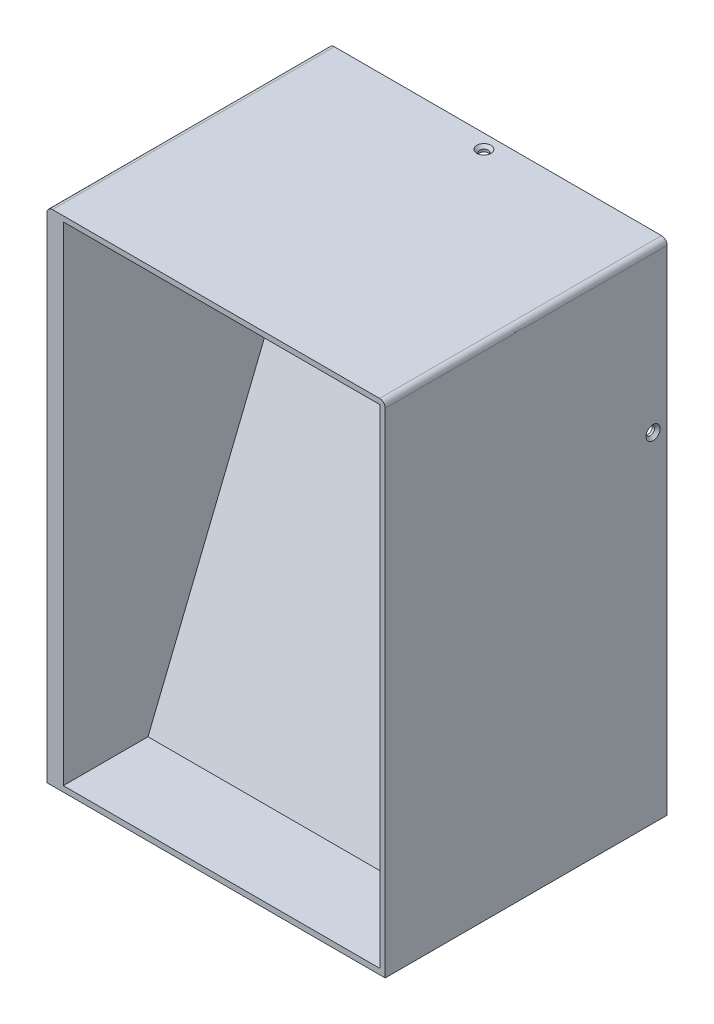
from build123d import *
from build123d.topology import SkipClean

# Parameters (mm, degrees)
SALIENTE_EXTRUIR1_DEPTH                              = 100
SALIENTE_EXTRUIR3_DEPTH                              = 60
CROQUIS8_R                                           = 7
CORTAR_EXTRUIR2_DEPTH                                = 7.5
CORTAR_EXTRUIR3_DEPTH                                = 25
SALIENTE_EXTRUIR5_REACH                              = 169.332
CROQUIS12_W                                          = 116.3
CROQUIS12_H                                          = 2
AVELLANADO_PARA_TORNILLO_CON_CABEZA_2_D              = 3
AVELLANADO_PARA_TORNILLO_CON_CABEZA_2_DEPTH          = 10
AVELLANADO_PARA_TORNILLO_CON_CABEZA_2_CSINK_D        = 5
AVELLANADO_PARA_TORNILLO_CON_CABEZA_2_CSINK_ANGLE    = 90
AVELLANADO_PARA_TORNILLO_CON_CABEZA_2_TIP            = 0.901290929
AVELLANADO_PARA_TORNILLO_CON_CABEZA_2_ON_D           = 3
AVELLANADO_PARA_TORNILLO_CON_CABEZA_2_ON_DEPTH       = 10
AVELLANADO_PARA_TORNILLO_CON_CABEZA_2_ON_CSINK_D     = 5
AVELLANADO_PARA_TORNILLO_CON_CABEZA_2_ON_CSINK_ANGLE = 90
AVELLANADO_PARA_TORNILLO_CON_CABEZA_2_ON_TIP         = 0.901290929
CROQUIS18_R                                          = 10
CROQUIS18_R_2                                        = 3.723403092
CORTAR_EXTRUIR6_DEPTH                                = 10
CROQUIS21_W                                          = 4
CROQUIS21_H                                          = 173.15
SALIENTE_EXTRUIR6_DEPTH                              = 90
CROQUIS22_W                                          = 86
CROQUIS22_H                                          = 172
CORTAR_EXTRUIR7_DEPTH                                = 3
CROQUIS23_W                                          = 3
CROQUIS23_H                                          = 172
CORTAR_EXTRUIR8_DEPTH                                = 2
CORTAR_EXTRUIR9_REACH                                = 195.972
CROQUIS24_W                                          = 3
CROQUIS24_H                                          = 10.09778391
CROQUIS25_W                                          = 116.3
CROQUIS25_H                                          = 2
CORTAR_EXTRUIR10_DEPTH                               = 10


# Read off the part's stored shape, not the designer's step: Recubrir-Lámina1
with BuildPart() as part:
    # Croquis1 → Saliente-Extruir1 (new body)
    with BuildSketch(Plane.XY):
        with BuildLine():
            Line((60, -120), (60, 55))
            ThreePointArc((60, 55), (59.414213562, 56.414213562), (58, 57))
            Line((58, 57), (-58, 57))
            ThreePointArc((-58, 57), (-59.414213562, 56.414213562), (-60, 55))
            Line((-60, 55), (-60, -120))
            Line((-60, -120), (60, -120))
        make_face()
        with BuildLine():
            Line((-57.95, -118), (57.95, -118))
            ThreePointArc((57.95, -118), (58.091421356, -117.941421356), (58.15, -117.8))
            Line((58.15, -117.8), (58.15, 54.95))
            ThreePointArc((58.15, 54.95), (58.091421356, 55.091421356), (57.95, 55.15))
            Line((57.95, 55.15), (-57.95, 55.15))
            ThreePointArc((-57.95, 55.15), (-58.091421356, 55.091421356), (-58.15, 54.95))
            Line((-58.15, 54.95), (-58.15, -117.8))
            ThreePointArc((-58.15, -117.8), (-58.091421356, -117.941421356), (-57.95, -118))
        make_face(mode=Mode.SUBTRACT)
    extrude(amount=SALIENTE_EXTRUIR1_DEPTH)

    # Croquis2 → Saliente-Extruir3 (add, symmetric)
    with BuildSketch(Plane(origin=(0, 0, 0), x_dir=(0, 0, -1), z_dir=(1, 0, 0))):
        Polygon((-51.903464864, 55.258422081), (-20, 0), (-67.842054117, -118.071815959), (-70, -118.071815959), (-22.220404934, -0.154145841), (-54.21286594, 55.258422081), align=None)
    extrude(amount=SALIENTE_EXTRUIR3_DEPTH, both=True)

    # Croquis6 → Revolución1 (revolve)
    with BuildSketch(Plane(origin=(0, 0, 0), x_dir=(0, 0, -1), z_dir=(1, 0, 0)), mode=Mode.PRIVATE) as revoluci_n1_sk:
        Polygon((-24.041451884, 7), (-25.773502692, 10), (-18.294962095, 10), (-18.294962095, 8), (-8.294962095, 8), (-8.294962095, 5), (-23.294962095, 5), (-23.294962095, 7), align=None)
    revolve(revoluci_n1_sk.sketch.rotate(Axis((0, 0, -70), (0, 0, 1)), 90), axis=Axis((0, 0, -70), (0, 0, 1)))

    # Croquis8 → Cortar-Extruir2 (cut, symmetric)
    with SkipClean():  # the faces are left unmerged after this step: merging them gives an invalid solid
        with BuildSketch(Plane.XY.offset(23.294962095)):
            with Locations(Location((0, 0, 0), (0, 0, 154.623066475))):
                Circle(CROQUIS8_R)
        extrude(amount=CORTAR_EXTRUIR2_DEPTH, both=True, mode=Mode.SUBTRACT)

    # Croquis10 → Cortar-Extruir3 (cut, symmetric)
    with BuildSketch(Plane(origin=(0, 0, 0), x_dir=(0, 0, -1), z_dir=(1, 0, 0))):
        Polygon((-29.700523202, 12.801799046), (-22.675993136, 0.634956072), (-22.220404934, -0.154145841), (-27.761841087, -13.830135337), (-29.486165756, -12.415050666), align=None)
    extrude(amount=CORTAR_EXTRUIR3_DEPTH, both=True, mode=Mode.SUBTRACT)

    # Saliente-Extruir5: up to this plane
    saliente_extruir5_end = Plane(origin=(60, 0, 20), z_dir=(0, 0.3755372500045795, 0.9268073013625854))
    # Croquis12 → Saliente-Extruir5 (add, up to the surface)
    with BuildSketch(Plane.XY, mode=Mode.PRIVATE) as saliente_extruir5_sk1:
        with Locations((0, -56.05)):
            Rectangle(CROQUIS12_W, CROQUIS12_H)
    saliente_extruir5_tool1 = split(extrude(saliente_extruir5_sk1.sketch, amount=SALIENTE_EXTRUIR5_REACH, mode=Mode.PRIVATE), bisect_by=saliente_extruir5_end, keep=Keep.BOTH, mode=Mode.PRIVATE)
    add(saliente_extruir5_tool1.solids().sort_by_distance((0, -56.05, 0))[0])

    # Croquis14 → Avellanado para tornillo con cabeza elev (revolve, cut)
    with BuildSketch(Plane(origin=(60, 0, 5), x_dir=(0, 0, -1), z_dir=(0, 1, 0))):
        Polygon((0, 0), (0, 10.901290929), (1.5, 10), (1.5, 1), (2.5, 0), align=None)
    avellanado_para_tornillo_con_cabeza_elev = revolve(axis=Axis((66.35, 0, 5), (-1, 0, 0)), mode=Mode.SUBTRACT)

    # Simetría1: Avellanado para tornillo con cabeza elev across plane
    add(avellanado_para_tornillo_con_cabeza_elev.mirror(Plane(origin=(0, 0, 0), x_dir=(0, 0, 1), z_dir=(1, 0, 0))), mode=Mode.SUBTRACT)

    # Avellanado para tornillo con cabeza  2
    with Locations(Plane(origin=(0, 57, 5), x_dir=(1, 0, 0), z_dir=(0, 1, 0))):
        with Locations((0, 0)):
            CounterSinkHole(AVELLANADO_PARA_TORNILLO_CON_CABEZA_2_D / 2, AVELLANADO_PARA_TORNILLO_CON_CABEZA_2_CSINK_D / 2, depth=AVELLANADO_PARA_TORNILLO_CON_CABEZA_2_DEPTH, counter_sink_angle=AVELLANADO_PARA_TORNILLO_CON_CABEZA_2_CSINK_ANGLE)
            with Locations((0, 0, -(AVELLANADO_PARA_TORNILLO_CON_CABEZA_2_DEPTH + AVELLANADO_PARA_TORNILLO_CON_CABEZA_2_TIP / 2))):  # 118° drill point
                Cone(0, AVELLANADO_PARA_TORNILLO_CON_CABEZA_2_D / 2, AVELLANADO_PARA_TORNILLO_CON_CABEZA_2_TIP, mode=Mode.SUBTRACT)

    # Avellanado para tornillo con cabeza 2 on
    with Locations(Plane(origin=(0, -120, 5), x_dir=(0, 0, -1), z_dir=(0, -1, 0))):
        with Locations((0, 0)):
            CounterSinkHole(AVELLANADO_PARA_TORNILLO_CON_CABEZA_2_ON_D / 2, AVELLANADO_PARA_TORNILLO_CON_CABEZA_2_ON_CSINK_D / 2, depth=AVELLANADO_PARA_TORNILLO_CON_CABEZA_2_ON_DEPTH, counter_sink_angle=AVELLANADO_PARA_TORNILLO_CON_CABEZA_2_ON_CSINK_ANGLE)
            with Locations((0, 0, -(AVELLANADO_PARA_TORNILLO_CON_CABEZA_2_ON_DEPTH + AVELLANADO_PARA_TORNILLO_CON_CABEZA_2_ON_TIP / 2))):  # 118° drill point
                Cone(0, AVELLANADO_PARA_TORNILLO_CON_CABEZA_2_ON_D / 2, AVELLANADO_PARA_TORNILLO_CON_CABEZA_2_ON_TIP, mode=Mode.SUBTRACT)

    # Croquis18 → Cortar-Extruir6 (cut)
    with BuildSketch(Plane(origin=(0, 0, 8.294962095), x_dir=(-1, 0, 0), z_dir=(0, 0, -1))):
        Circle(CROQUIS18_R)
        Circle(CROQUIS18_R_2, mode=Mode.SUBTRACT)
    extrude(amount=-CORTAR_EXTRUIR6_DEPTH, mode=Mode.SUBTRACT)

    # Recubrir-Lámina1 outline → Recubrir-Lámina1 (revolve)
    with BuildSketch(Plane.XZ):
        Polygon((7, 18.294962095), (2.5, 8.294962095), (4.69317122, 8.294962095), (9.19317122, 18.294962095), align=None)
    revolve(axis=Axis((0, 0, 0), (0, 0, 1)))

    # Croquis21 → Saliente-Extruir6 (add)
    with BuildSketch(Plane.XY.offset(100)):
        with Locations((-56.15, -31.425)):
            Rectangle(CROQUIS21_W, CROQUIS21_H)
    extrude(amount=-SALIENTE_EXTRUIR6_DEPTH)

    # Croquis22 → Cortar-Extruir7 (cut)
    with BuildSketch(Plane.ZY.offset(60)):
        with Locations((54.5, -31)):
            Rectangle(CROQUIS22_W, CROQUIS22_H)
    extrude(amount=-CORTAR_EXTRUIR7_DEPTH, mode=Mode.SUBTRACT)

    # Croquis23 → Cortar-Extruir8 (cut)
    with BuildSketch(Plane.ZY.offset(57)):
        with Locations((54.5, -31)):
            Rectangle(CROQUIS23_W, CROQUIS23_H)
    extrude(amount=-CORTAR_EXTRUIR8_DEPTH, mode=Mode.SUBTRACT)

    # Croquis24 → Cortar-Extruir9 (cut, up to next)
    with BuildSketch(Plane.ZY.offset(55), mode=Mode.PRIVATE) as cortar_extruir9_sk1:
        with Locations((54.5, -111.951108045)):
            Rectangle(CROQUIS24_W, CROQUIS24_H)
    cortar_extruir9_tool1 = extrude(cortar_extruir9_sk1.sketch, amount=-CORTAR_EXTRUIR9_REACH, mode=Mode.PRIVATE) & part.part
    add(cortar_extruir9_tool1.solids().sort_by_distance((-55, -111.951108, 54.5))[0], mode=Mode.SUBTRACT)

    # Croquis25 → Cortar-Extruir10 (cut)
    with BuildSketch(Plane(origin=(0, 0, 0), x_dir=(-1, 0, 0), z_dir=(0, 0, -1))):
        with Locations((0, -56.05)):
            Rectangle(CROQUIS25_W, CROQUIS25_H)
    extrude(amount=-CORTAR_EXTRUIR10_DEPTH, mode=Mode.SUBTRACT)


solid = part.part
